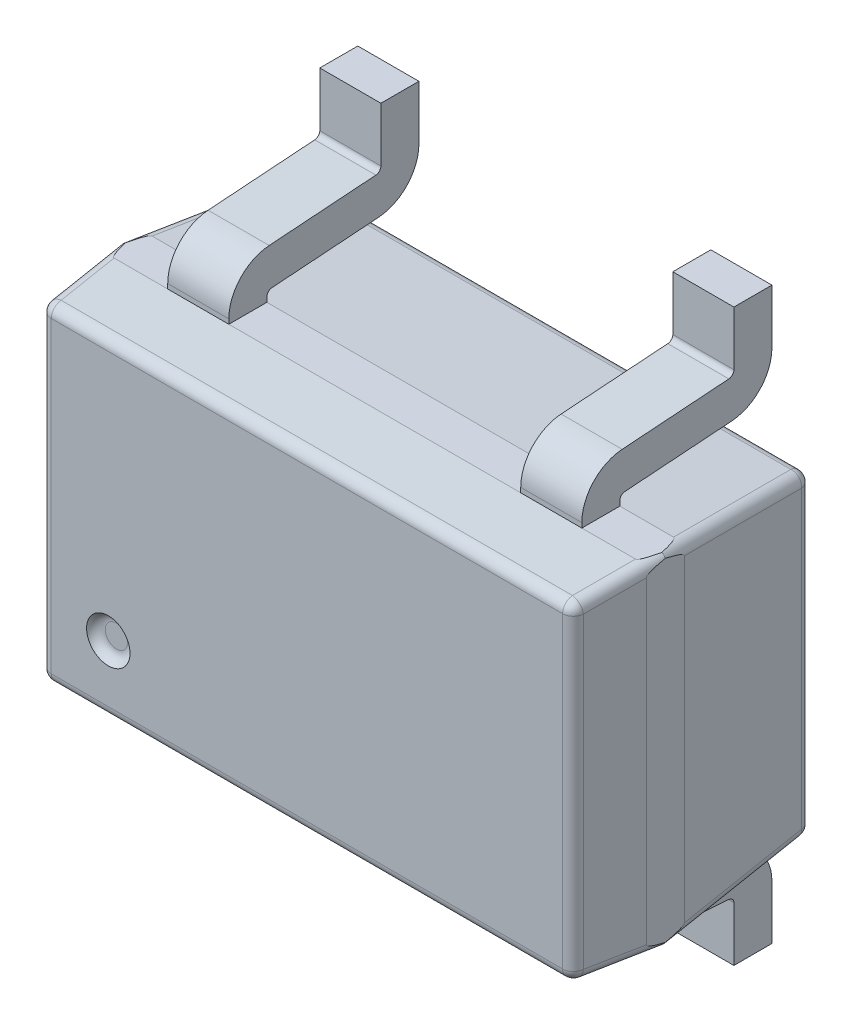
from build123d import *
from OCP.BRepFilletAPI import BRepFilletAPI_MakeChamfer

# Parameters (mm, degrees)
SALIENTE_EXTRUIR1_START = 0.05
CROQUIS1_W              = 2
CROQUIS1_H              = 1.25
SALIENTE_EXTRUIR1_DEPTH = 0.51
CHAFL_N1_SIZE           = 0.51
CHAFL_N1_SIZE_2         = 0.044619218
CROQUIS2_W              = 2
CROQUIS2_H              = 1.25
SALIENTE_EXTRUIR2_DEPTH = 0.39
CHAFL_N2_SIZE           = 0.25
CHAFL_N2_SIZE2          = 0.021872166
REDONDEO1_R             = 0.04
EXTRUIR_L_MINA1_DEPTH   = 0.1125
MATRIZL2_COUNT          = 2
MATRIZL2_PITCH          = 0.65
MATRIZL2_COL_COUNT      = 2
MATRIZL2_COL_PITCH      = 0.65
SIMETR_A2_COPY_1_DEPTH  = 0.1125
SIMETR_A2_COPY_2_DEPTH  = 0.1125
CROQUIS7_W              = 0.7
CROQUIS7_H              = 0.425
CORTAR_EXTRUIR1_DEPTH   = 0.225
CROQUIS8_R              = 0.08
CORTAR_EXTRUIR3_DEPTH   = 0.03
REDONDEO2_R             = 0.04


with BuildPart() as part:
    # Croquis1 → Saliente-Extruir1 (new body)
    with BuildSketch(Plane.XY.offset(SALIENTE_EXTRUIR1_START)):
        Rectangle(CROQUIS1_W, CROQUIS1_H)
    extrude(amount=SALIENTE_EXTRUIR1_DEPTH)

    # Chaflán1
    # the kernel refuses this chamfer: 0.51, 0.044619218 mm, written as the material it takes off along each edge
    with BuildSketch(Plane(origin=(2.325813381, 0.625, 0.05), x_dir=(0, 0, 1), z_dir=(-1, 0, 0)), Plane(origin=(-2.325813381, -0.625, 0.05), x_dir=(0, 0, 1), z_dir=(1, 0, 0))) as chafl_n1_piece_1:
        Polygon((CHAFL_N1_SIZE, 0), (0, -CHAFL_N1_SIZE_2 * 1.00000000892), (0, 0), align=None)
    extrude(amount=4.651626761, mode=Mode.SUBTRACT)
    with BuildSketch(Plane(origin=(-1, 1.950813381, 0.05), x_dir=(0, 0, 1), z_dir=(0, -1, 0)), Plane(origin=(1, -1.950813381, 0.05), x_dir=(0, 0, 1), z_dir=(0, 1, 0))) as chafl_n1_piece_2:
        Polygon((CHAFL_N1_SIZE, 0), (0, -CHAFL_N1_SIZE_2 * 1.00000000892), (0, 0), align=None)
    extrude(amount=3.901626761, mode=Mode.SUBTRACT)

    # Croquis2 → Saliente-Extruir2 (add)
    with BuildSketch(Plane.XY.offset(0.56)):
        Rectangle(CROQUIS2_W, CROQUIS2_H)
    extrude(amount=SALIENTE_EXTRUIR2_DEPTH)

    # Chaflán2: one chamfer whose edges measure the first distance from different faces: ONE call of the kernel's chamfer builder (chamfer() names one face for all edges)
    chafl_n2_edges_1 = [part.edges().sort_by_distance(p)[0] for p in [
        (1, 0, 0.95),
    ]]
    chafl_n2_side_1 = [part.faces().sort_by_distance(p)[0] for p in [
        (1, 0, 0.755),
    ]]
    chafl_n2_edges_2 = [part.edges().sort_by_distance(p)[0] for p in [
        (0, 0.625, 0.95),
    ]]
    chafl_n2_side_2 = [part.faces().sort_by_distance(p)[0] for p in [
        (0, 0.625, 0.755),
    ]]
    chafl_n2_edges_3 = [part.edges().sort_by_distance(p)[0] for p in [
        (-1, 0, 0.95),
    ]]
    chafl_n2_side_3 = [part.faces().sort_by_distance(p)[0] for p in [
        (-1, 0, 0.755),
    ]]
    chafl_n2_edges_4 = [part.edges().sort_by_distance(p)[0] for p in [
        (0, -0.625, 0.95),
    ]]
    chafl_n2_side_4 = [part.faces().sort_by_distance(p)[0] for p in [
        (0, -0.625, 0.755),
    ]]
    chafl_n2 = BRepFilletAPI_MakeChamfer(part.part.solid().wrapped)
    for e in chafl_n2_edges_1:
        chafl_n2.Add(CHAFL_N2_SIZE, CHAFL_N2_SIZE2, e.wrapped, chafl_n2_side_1[0].wrapped)  # the first distance lies on this face
    for e in chafl_n2_edges_2:
        chafl_n2.Add(CHAFL_N2_SIZE, CHAFL_N2_SIZE2, e.wrapped, chafl_n2_side_2[0].wrapped)  # the first distance lies on this face
    for e in chafl_n2_edges_3:
        chafl_n2.Add(CHAFL_N2_SIZE, CHAFL_N2_SIZE2, e.wrapped, chafl_n2_side_3[0].wrapped)  # the first distance lies on this face
    for e in chafl_n2_edges_4:
        chafl_n2.Add(CHAFL_N2_SIZE, CHAFL_N2_SIZE2, e.wrapped, chafl_n2_side_4[0].wrapped)  # the first distance lies on this face
    add(Compound.cast(chafl_n2.Shape()), mode=Mode.REPLACE)

    # Redondeo1
    # the kernel refuses this fillet: 0.04 mm, written as the material it takes off along each edge
    with BuildSketch(Plane(origin=(0.918727535, 0.543727535, 0.09), x_dir=(-0.7071067811865475, 0.7071067811865475, 0), z_dir=(0.5431604763461051, 0.5431604763461051, -0.6402760294364802))) as redondeo1_piece_1_section:
        Polygon((-0.0785695, -0.0785695), (0.0785695, -0.0785695), (0.0785695, 0.0785695), (-0.0785695, 0.0785695), align=None)
    redondeo1_piece_1 = extrude(amount=0.0785695, mode=Mode.PRIVATE)
    redondeo1_piece_1 = split(redondeo1_piece_1, bisect_by=Plane(origin=(0.918727535, 0.543727535, 0.09), z_dir=(0, 1, 0)), keep=Keep.TOP, mode=Mode.PRIVATE)
    redondeo1_piece_1 = split(redondeo1_piece_1, bisect_by=Plane(origin=(0.918727535, 0.543727535, 0.09), z_dir=(-0.08682659386383014, -0.08682659386383014, -0.9924325091390401)), keep=Keep.TOP, mode=Mode.PRIVATE)
    redondeo1_piece_1 = split(redondeo1_piece_1, bisect_by=Plane(origin=(0.918727535, 0.543727535, 0.09), z_dir=(1, 0, 0)), keep=Keep.TOP, mode=Mode.PRIVATE)
    redondeo1_piece_1 = split(redondeo1_piece_1, bisect_by=Plane(origin=(0.918727535, 0.543727535, 0.05), z_dir=(0, 0, 1)), keep=Keep.TOP, mode=Mode.PRIVATE)
    redondeo1_piece_1 = split(redondeo1_piece_1, bisect_by=Plane(origin=(0.958575323, 0.543727535, 0.08651377), z_dir=(-0.9961946980917825, 0, 0.08715574274723596)), keep=Keep.TOP, mode=Mode.PRIVATE)
    redondeo1_piece_1 = split(redondeo1_piece_1, bisect_by=Plane(origin=(0.918727535, 0.583575323, 0.08651377), z_dir=(0, -0.9961946980917825, 0.08715574274723596)), keep=Keep.TOP, mode=Mode.PRIVATE)
    redondeo1_piece_1 = redondeo1_piece_1 - Plane(origin=(0.918727535, 0.543727535, 0.09), x_dir=(-0.5431604763461051, -0.5431604763461051, 0.6402760294364802), z_dir=(-0.7071067811865475, 0.7071067811865475, 0)) * Sphere(REDONDEO1_R, mode=Mode.PRIVATE)
    add(redondeo1_piece_1, mode=Mode.SUBTRACT)
    with BuildSketch(Plane(origin=(-0.918727535, 0.543727535, 0.09), x_dir=(-0.7071067811865475, -0.7071067811865475, 0), z_dir=(-0.5431604763461051, 0.5431604763461051, -0.6402760294364802))) as redondeo1_piece_2_section:
        Polygon((-0.0785695, -0.0785695), (0.0785695, -0.0785695), (0.0785695, 0.0785695), (-0.0785695, 0.0785695), align=None)
    redondeo1_piece_2 = extrude(amount=0.0785695, mode=Mode.PRIVATE)
    redondeo1_piece_2 = split(redondeo1_piece_2, bisect_by=Plane(origin=(-0.918727535, 0.543727535, 0.09), z_dir=(-1, 0, 0)), keep=Keep.TOP, mode=Mode.PRIVATE)
    redondeo1_piece_2 = split(redondeo1_piece_2, bisect_by=Plane(origin=(-0.918727535, 0.543727535, 0.09), z_dir=(0.08682659386383014, -0.08682659386383014, -0.9924325091390401)), keep=Keep.TOP, mode=Mode.PRIVATE)
    redondeo1_piece_2 = split(redondeo1_piece_2, bisect_by=Plane(origin=(-0.918727535, 0.543727535, 0.09), z_dir=(0, 1, 0)), keep=Keep.TOP, mode=Mode.PRIVATE)
    redondeo1_piece_2 = split(redondeo1_piece_2, bisect_by=Plane(origin=(-0.918727535, 0.543727535, 0.05), z_dir=(0, 0, 1)), keep=Keep.TOP, mode=Mode.PRIVATE)
    redondeo1_piece_2 = split(redondeo1_piece_2, bisect_by=Plane(origin=(-0.918727535, 0.583575323, 0.08651377), z_dir=(0, -0.9961946980917825, 0.08715574274723596)), keep=Keep.TOP, mode=Mode.PRIVATE)
    redondeo1_piece_2 = split(redondeo1_piece_2, bisect_by=Plane(origin=(-0.958575323, 0.543727535, 0.08651377), z_dir=(0.9961946980917825, 0, 0.08715574274723596)), keep=Keep.TOP, mode=Mode.PRIVATE)
    redondeo1_piece_2 = redondeo1_piece_2 - Plane(origin=(-0.918727535, 0.543727535, 0.09), x_dir=(0.5431604763461051, -0.5431604763461051, 0.6402760294364802), z_dir=(-0.7071067811865475, -0.7071067811865475, 0)) * Sphere(REDONDEO1_R, mode=Mode.PRIVATE)
    add(redondeo1_piece_2, mode=Mode.SUBTRACT)
    with BuildSketch(Plane(origin=(-0.918727535, -0.543727535, 0.09), x_dir=(0.7071067811865475, -0.7071067811865475, 0), z_dir=(-0.5431604763461051, -0.5431604763461051, -0.6402760294364802))) as redondeo1_piece_3_section:
        Polygon((-0.0785695, -0.0785695), (0.0785695, -0.0785695), (0.0785695, 0.0785695), (-0.0785695, 0.0785695), align=None)
    redondeo1_piece_3 = extrude(amount=0.0785695, mode=Mode.PRIVATE)
    redondeo1_piece_3 = split(redondeo1_piece_3, bisect_by=Plane(origin=(-0.918727535, -0.543727535, 0.09), z_dir=(-1, 0, 0)), keep=Keep.TOP, mode=Mode.PRIVATE)
    redondeo1_piece_3 = split(redondeo1_piece_3, bisect_by=Plane(origin=(-0.918727535, -0.543727535, 0.09), z_dir=(0.08682659386383014, 0.08682659386383014, -0.9924325091390401)), keep=Keep.TOP, mode=Mode.PRIVATE)
    redondeo1_piece_3 = split(redondeo1_piece_3, bisect_by=Plane(origin=(-0.918727535, -0.543727535, 0.09), z_dir=(0, -1, 0)), keep=Keep.TOP, mode=Mode.PRIVATE)
    redondeo1_piece_3 = split(redondeo1_piece_3, bisect_by=Plane(origin=(-0.918727535, -0.543727535, 0.05), z_dir=(0, 0, 1)), keep=Keep.TOP, mode=Mode.PRIVATE)
    redondeo1_piece_3 = split(redondeo1_piece_3, bisect_by=Plane(origin=(-0.918727535, -0.583575323, 0.08651377), z_dir=(0, 0.9961946980917825, 0.08715574274723596)), keep=Keep.TOP, mode=Mode.PRIVATE)
    redondeo1_piece_3 = split(redondeo1_piece_3, bisect_by=Plane(origin=(-0.958575323, -0.543727535, 0.08651377), z_dir=(0.9961946980917825, 0, 0.08715574274723596)), keep=Keep.TOP, mode=Mode.PRIVATE)
    redondeo1_piece_3 = redondeo1_piece_3 - Plane(origin=(-0.918727535, -0.543727535, 0.09), x_dir=(0.5431604763461051, 0.5431604763461051, 0.6402760294364802), z_dir=(0.7071067811865475, -0.7071067811865475, 0)) * Sphere(REDONDEO1_R, mode=Mode.PRIVATE)
    add(redondeo1_piece_3, mode=Mode.SUBTRACT)
    with BuildSketch(Plane(origin=(0.918727535, -0.543727535, 0.09), x_dir=(0.05900350758257069, -0.7359928340769734, 0.6744131777184507), z_dir=(0.5431604763461051, -0.5431604763461051, -0.6402760294364802))) as redondeo1_piece_4_section:
        Polygon((-0.0785695, -0.0785695), (0.0785695, -0.0785695), (0.0785695, 0.0785695), (-0.0785695, 0.0785695), align=None)
    redondeo1_piece_4 = extrude(amount=0.0785695, mode=Mode.PRIVATE)
    redondeo1_piece_4 = split(redondeo1_piece_4, bisect_by=Plane(origin=(0.918727535, -0.543727535, 0.09), z_dir=(0, -1, 0)), keep=Keep.TOP, mode=Mode.PRIVATE)
    redondeo1_piece_4 = split(redondeo1_piece_4, bisect_by=Plane(origin=(0.918727535, -0.543727535, 0.09), z_dir=(1, 0, 0)), keep=Keep.TOP, mode=Mode.PRIVATE)
    redondeo1_piece_4 = split(redondeo1_piece_4, bisect_by=Plane(origin=(0.918727535, -0.543727535, 0.09), z_dir=(-0.08682659386383014, 0.08682659386383014, -0.9924325091390401)), keep=Keep.TOP, mode=Mode.PRIVATE)
    redondeo1_piece_4 = split(redondeo1_piece_4, bisect_by=Plane(origin=(0.958575323, -0.543727535, 0.08651377), z_dir=(-0.9961946980917825, 0, 0.08715574274723596)), keep=Keep.TOP, mode=Mode.PRIVATE)
    redondeo1_piece_4 = split(redondeo1_piece_4, bisect_by=Plane(origin=(0.918727535, -0.543727535, 0.05), z_dir=(0, 0, 1)), keep=Keep.TOP, mode=Mode.PRIVATE)
    redondeo1_piece_4 = split(redondeo1_piece_4, bisect_by=Plane(origin=(0.918727535, -0.583575323, 0.08651377), z_dir=(0, 0.9961946980917825, 0.08715574274723596)), keep=Keep.TOP, mode=Mode.PRIVATE)
    redondeo1_piece_4 = redondeo1_piece_4 - Plane(origin=(0.918727535, -0.543727535, 0.09), x_dir=(-0.5431604763461051, 0.5431604763461051, 0.6402760294364802), z_dir=(0.05900350758257069, -0.7359928340769734, 0.6744131777184507)) * Sphere(REDONDEO1_R, mode=Mode.PRIVATE)
    add(redondeo1_piece_4, mode=Mode.SUBTRACT)
    with BuildSketch(Plane(origin=(0.941474587, -0.566474587, 0.91), x_dir=(-0.7071067811865476, -0.7071067811865476, 0), z_dir=(0.5431604763459367, -0.5431604763459367, 0.6402760294367659))) as redondeo1_piece_5_section:
        Polygon((-0.0785695, -0.0785695), (0.0785695, -0.0785695), (0.0785695, 0.0785695), (-0.0785695, 0.0785695), align=None)
    redondeo1_piece_5 = extrude(amount=0.0785695, mode=Mode.PRIVATE)
    redondeo1_piece_5 = split(redondeo1_piece_5, bisect_by=Plane(origin=(0.941474587, -0.566474587, 0.91), z_dir=(0, -1, 0)), keep=Keep.TOP, mode=Mode.PRIVATE)
    redondeo1_piece_5 = split(redondeo1_piece_5, bisect_by=Plane(origin=(0.941474587, -0.566474587, 0.91), z_dir=(-0.08682659386424758, 0.08682659386424758, 0.9924325091389671)), keep=Keep.TOP, mode=Mode.PRIVATE)
    redondeo1_piece_5 = split(redondeo1_piece_5, bisect_by=Plane(origin=(0.941474587, -0.566474587, 0.91), z_dir=(1, 0, 0)), keep=Keep.TOP, mode=Mode.PRIVATE)
    redondeo1_piece_5 = split(redondeo1_piece_5, bisect_by=Plane(origin=(0.941474587, -0.566474587, 0.95), z_dir=(0, 0, -1)), keep=Keep.TOP, mode=Mode.PRIVATE)
    redondeo1_piece_5 = split(redondeo1_piece_5, bisect_by=Plane(origin=(0.981322375, -0.566474587, 0.91348623), z_dir=(-0.9961946980917455, 0, -0.08715574274765817)), keep=Keep.TOP, mode=Mode.PRIVATE)
    redondeo1_piece_5 = split(redondeo1_piece_5, bisect_by=Plane(origin=(0.941474587, -0.606322375, 0.91348623), z_dir=(0, 0.9961946980917455, -0.08715574274765817)), keep=Keep.TOP, mode=Mode.PRIVATE)
    redondeo1_piece_5 = redondeo1_piece_5 - Plane(origin=(0.941474587, -0.566474587, 0.91), x_dir=(-0.5431604763459367, 0.5431604763459367, -0.6402760294367659), z_dir=(-0.7071067811865476, -0.7071067811865476, 0)) * Sphere(REDONDEO1_R, mode=Mode.PRIVATE)
    add(redondeo1_piece_5, mode=Mode.SUBTRACT)
    with BuildSketch(Plane(origin=(0.941474587, 0.566474587, 0.91), x_dir=(0.7071067811865476, -0.7071067811865476, 0), z_dir=(0.5431604763459367, 0.5431604763459367, 0.6402760294367659))) as redondeo1_piece_6_section:
        Polygon((-0.0785695, -0.0785695), (0.0785695, -0.0785695), (0.0785695, 0.0785695), (-0.0785695, 0.0785695), align=None)
    redondeo1_piece_6 = extrude(amount=0.0785695, mode=Mode.PRIVATE)
    redondeo1_piece_6 = split(redondeo1_piece_6, bisect_by=Plane(origin=(0.941474587, 0.566474587, 0.91), z_dir=(0, 1, 0)), keep=Keep.TOP, mode=Mode.PRIVATE)
    redondeo1_piece_6 = split(redondeo1_piece_6, bisect_by=Plane(origin=(0.941474587, 0.566474587, 0.91), z_dir=(-0.08682659386424758, -0.08682659386424758, 0.9924325091389671)), keep=Keep.TOP, mode=Mode.PRIVATE)
    redondeo1_piece_6 = split(redondeo1_piece_6, bisect_by=Plane(origin=(0.941474587, 0.566474587, 0.91), z_dir=(1, 0, 0)), keep=Keep.TOP, mode=Mode.PRIVATE)
    redondeo1_piece_6 = split(redondeo1_piece_6, bisect_by=Plane(origin=(0.941474587, 0.566474587, 0.95), z_dir=(0, 0, -1)), keep=Keep.TOP, mode=Mode.PRIVATE)
    redondeo1_piece_6 = split(redondeo1_piece_6, bisect_by=Plane(origin=(0.981322375, 0.566474587, 0.91348623), z_dir=(-0.9961946980917455, 0, -0.08715574274765817)), keep=Keep.TOP, mode=Mode.PRIVATE)
    redondeo1_piece_6 = split(redondeo1_piece_6, bisect_by=Plane(origin=(0.941474587, 0.606322375, 0.91348623), z_dir=(0, -0.9961946980917455, -0.08715574274765817)), keep=Keep.TOP, mode=Mode.PRIVATE)
    redondeo1_piece_6 = redondeo1_piece_6 - Plane(origin=(0.941474587, 0.566474587, 0.91), x_dir=(-0.5431604763459367, -0.5431604763459367, -0.6402760294367659), z_dir=(0.7071067811865476, -0.7071067811865476, 0)) * Sphere(REDONDEO1_R, mode=Mode.PRIVATE)
    add(redondeo1_piece_6, mode=Mode.SUBTRACT)
    with BuildSketch(Plane(origin=(-0.941474587, -0.566474587, 0.91), x_dir=(-0.7071067811865476, 0.7071067811865476, 0), z_dir=(-0.5431604763459367, -0.5431604763459367, 0.6402760294367659))) as redondeo1_piece_7_section:
        Polygon((-0.0785695, -0.0785695), (0.0785695, -0.0785695), (0.0785695, 0.0785695), (-0.0785695, 0.0785695), align=None)
    redondeo1_piece_7 = extrude(amount=0.0785695, mode=Mode.PRIVATE)
    redondeo1_piece_7 = split(redondeo1_piece_7, bisect_by=Plane(origin=(-0.941474587, -0.566474587, 0.91), z_dir=(-1, 0, 0)), keep=Keep.TOP, mode=Mode.PRIVATE)
    redondeo1_piece_7 = split(redondeo1_piece_7, bisect_by=Plane(origin=(-0.941474587, -0.566474587, 0.91), z_dir=(0.08682659386424758, 0.08682659386424758, 0.9924325091389671)), keep=Keep.TOP, mode=Mode.PRIVATE)
    redondeo1_piece_7 = split(redondeo1_piece_7, bisect_by=Plane(origin=(-0.941474587, -0.566474587, 0.91), z_dir=(0, -1, 0)), keep=Keep.TOP, mode=Mode.PRIVATE)
    redondeo1_piece_7 = split(redondeo1_piece_7, bisect_by=Plane(origin=(-0.941474587, -0.566474587, 0.95), z_dir=(0, 0, -1)), keep=Keep.TOP, mode=Mode.PRIVATE)
    redondeo1_piece_7 = split(redondeo1_piece_7, bisect_by=Plane(origin=(-0.941474587, -0.606322375, 0.91348623), z_dir=(0, 0.9961946980917455, -0.08715574274765817)), keep=Keep.TOP, mode=Mode.PRIVATE)
    redondeo1_piece_7 = split(redondeo1_piece_7, bisect_by=Plane(origin=(-0.981322375, -0.566474587, 0.91348623), z_dir=(0.9961946980917455, 0, -0.08715574274765817)), keep=Keep.TOP, mode=Mode.PRIVATE)
    redondeo1_piece_7 = redondeo1_piece_7 - Plane(origin=(-0.941474587, -0.566474587, 0.91), x_dir=(0.5431604763459367, 0.5431604763459367, -0.6402760294367659), z_dir=(-0.7071067811865476, 0.7071067811865476, 0)) * Sphere(REDONDEO1_R, mode=Mode.PRIVATE)
    add(redondeo1_piece_7, mode=Mode.SUBTRACT)
    with BuildSketch(Plane(origin=(-0.941474587, 0.566474587, 0.91), x_dir=(0.7071067811865476, 0.7071067811865476, 0), z_dir=(-0.5431604763459367, 0.5431604763459367, 0.6402760294367659))) as redondeo1_piece_8_section:
        Polygon((-0.0785695, -0.0785695), (0.0785695, -0.0785695), (0.0785695, 0.0785695), (-0.0785695, 0.0785695), align=None)
    redondeo1_piece_8 = extrude(amount=0.0785695, mode=Mode.PRIVATE)
    redondeo1_piece_8 = split(redondeo1_piece_8, bisect_by=Plane(origin=(-0.941474587, 0.566474587, 0.91), z_dir=(-1, 0, 0)), keep=Keep.TOP, mode=Mode.PRIVATE)
    redondeo1_piece_8 = split(redondeo1_piece_8, bisect_by=Plane(origin=(-0.941474587, 0.566474587, 0.91), z_dir=(0.08682659386424758, -0.08682659386424758, 0.9924325091389671)), keep=Keep.TOP, mode=Mode.PRIVATE)
    redondeo1_piece_8 = split(redondeo1_piece_8, bisect_by=Plane(origin=(-0.941474587, 0.566474587, 0.91), z_dir=(0, 1, 0)), keep=Keep.TOP, mode=Mode.PRIVATE)
    redondeo1_piece_8 = split(redondeo1_piece_8, bisect_by=Plane(origin=(-0.941474587, 0.566474587, 0.95), z_dir=(0, 0, -1)), keep=Keep.TOP, mode=Mode.PRIVATE)
    redondeo1_piece_8 = split(redondeo1_piece_8, bisect_by=Plane(origin=(-0.941474587, 0.606322375, 0.91348623), z_dir=(0, -0.9961946980917455, -0.08715574274765817)), keep=Keep.TOP, mode=Mode.PRIVATE)
    redondeo1_piece_8 = split(redondeo1_piece_8, bisect_by=Plane(origin=(-0.981322375, 0.566474587, 0.91348623), z_dir=(0.9961946980917455, 0, -0.08715574274765817)), keep=Keep.TOP, mode=Mode.PRIVATE)
    redondeo1_piece_8 = redondeo1_piece_8 - Plane(origin=(-0.941474587, 0.566474587, 0.91), x_dir=(0.5431604763459367, -0.5431604763459367, -0.6402760294367659), z_dir=(0.7071067811865476, 0.7071067811865476, 0)) * Sphere(REDONDEO1_R, mode=Mode.PRIVATE)
    add(redondeo1_piece_8, mode=Mode.SUBTRACT)
    with BuildSketch(Plane(origin=(0.918727535, 0.580380782, 0.05), x_dir=(0, -1, 0), z_dir=(-1, 0, 0))) as redondeo1_piece_9:
        with BuildLine():
            CenterArc((REDONDEO1_R * 0.916331174018, REDONDEO1_R), REDONDEO1_R, 185, 85)
            Line((-REDONDEO1_R * 0.079863524074, REDONDEO1_R * 0.912844257253), (0, 0))
            Line((0, 0), (REDONDEO1_R * 0.916331174018, 0))
        make_face()
    extrude(amount=1.837455069, mode=Mode.SUBTRACT)
    with BuildSketch(Plane(origin=(-0.955380782, 0.543727535, 0.05), x_dir=(-0.08715574274723663, 0, 0.9961946980917824), z_dir=(0, -1, 0))) as redondeo1_piece_10:
        with BuildLine():
            CenterArc((REDONDEO1_R * 0.916331174018, -REDONDEO1_R), REDONDEO1_R, 90, 85)
            Line((-REDONDEO1_R * 0.079863524074, -REDONDEO1_R * 0.912844257253), (0, 0))
            Line((0, 0), (REDONDEO1_R * 0.916331174018, 0))
        make_face()
    extrude(amount=1.087455069, mode=Mode.SUBTRACT)
    with BuildSketch(Plane(origin=(-0.918727535, -0.580380782, 0.05), x_dir=(0, -0.08715574274723663, 0.9961946980917824), z_dir=(1, 0, 0))) as redondeo1_piece_11:
        with BuildLine():
            CenterArc((REDONDEO1_R * 0.916331174018, -REDONDEO1_R), REDONDEO1_R, 90, 85)
            Line((-REDONDEO1_R * 0.079863524074, -REDONDEO1_R * 0.912844257253), (0, 0))
            Line((0, 0), (REDONDEO1_R * 0.916331174018, 0))
        make_face()
    extrude(amount=1.837455069, mode=Mode.SUBTRACT)
    with BuildSketch(Plane(origin=(0.955380782, -0.543727535, 0.05), x_dir=(-1, 0, 0), z_dir=(0, 1, 0))) as redondeo1_piece_12:
        with BuildLine():
            CenterArc((REDONDEO1_R * 0.916331174018, REDONDEO1_R), REDONDEO1_R, 185, 85)
            Line((-REDONDEO1_R * 0.079863524074, REDONDEO1_R * 0.912844257253), (0, 0))
            Line((0, 0), (REDONDEO1_R * 0.916331174018, 0))
        make_face()
    extrude(amount=1.087455069, mode=Mode.SUBTRACT)
    with BuildSketch(Plane(origin=(0.978127834, -0.566474587, 0.95), x_dir=(-1, 0, 0), z_dir=(0, 1, 0))) as redondeo1_piece_13:
        with BuildLine():
            CenterArc((REDONDEO1_R * 0.916331174017, -REDONDEO1_R), REDONDEO1_R, 90, 85)
            Line((-REDONDEO1_R * 0.0798635240743, -REDONDEO1_R * 0.912844257252), (0, 0))
            Line((0, 0), (REDONDEO1_R * 0.916331174017, 0))
        make_face()
    extrude(amount=1.132949174, mode=Mode.SUBTRACT)
    with BuildSketch(Plane(origin=(-0.941474587, -0.603127834, 0.95), x_dir=(0, -0.08715574274765546, -0.9961946980917458), z_dir=(1, 0, 0))) as redondeo1_piece_14:
        with BuildLine():
            CenterArc((REDONDEO1_R * 0.916331174017, REDONDEO1_R), REDONDEO1_R, 185, 85)
            Line((-REDONDEO1_R * 0.0798635240743, REDONDEO1_R * 0.912844257252), (0, 0))
            Line((0, 0), (REDONDEO1_R * 0.916331174017, 0))
        make_face()
    extrude(amount=1.882949174, mode=Mode.SUBTRACT)
    with BuildSketch(Plane(origin=(-0.978127834, 0.566474587, 0.95), x_dir=(-0.08715574274765546, 0, -0.9961946980917458), z_dir=(0, -1, 0))) as redondeo1_piece_15:
        with BuildLine():
            CenterArc((REDONDEO1_R * 0.916331174017, REDONDEO1_R), REDONDEO1_R, 185, 85)
            Line((-REDONDEO1_R * 0.0798635240743, REDONDEO1_R * 0.912844257252), (0, 0))
            Line((0, 0), (REDONDEO1_R * 0.916331174017, 0))
        make_face()
    extrude(amount=1.132949174, mode=Mode.SUBTRACT)
    with BuildSketch(Plane(origin=(0.941474587, 0.603127834, 0.95), x_dir=(0, -1, 0), z_dir=(-1, 0, 0))) as redondeo1_piece_16:
        with BuildLine():
            CenterArc((REDONDEO1_R * 0.916331174017, -REDONDEO1_R), REDONDEO1_R, 90, 85)
            Line((-REDONDEO1_R * 0.0798635240743, -REDONDEO1_R * 0.912844257252), (0, 0))
            Line((0, 0), (REDONDEO1_R * 0.916331174017, 0))
        make_face()
    extrude(amount=1.882949174, mode=Mode.SUBTRACT)
    with BuildSketch(Plane(origin=(0.958274916, -0.583274916, 0.083080105), x_dir=(-0.9962234400966509, -0.007567436278422571, 0.08649619246051539), z_dir=(0.08682659386383014, -0.08682659386383014, 0.9924325091390401)), Plane(origin=(-1.043084767, -0.668084767, 1.052461143), x_dir=(0.9962234400966511, -0.007567436278414003, 0.08649619246051615), z_dir=(0.08682659386383014, 0.08682659386383014, -0.9924325091390401))) as redondeo1_piece_17:
        with BuildLine():
            CenterArc((REDONDEO1_R * 0.992432509139, -REDONDEO1_R), REDONDEO1_R, 90, 89.564769998)
            Line((-REDONDEO1_R * 0.00753863989871, -REDONDEO1_R * 0.992403876506), (0, 0))
            Line((0, 0), (REDONDEO1_R * 0.992432509139, 0))
        make_face()
    extrude(amount=0.976772757, mode=Mode.SUBTRACT)
    with BuildSketch(Plane(origin=(1.043084767, -0.668084767, 0.207538857), x_dir=(-0.9962234400966146, -0.0075674362784873385, -0.08649619246092878), z_dir=(-0.08682659386424758, 0.08682659386424758, 0.9924325091389671)), Plane(origin=(1.043084767, 0.668084767, 0.207538857), x_dir=(0.007567436278490113, -0.9962234400966146, -0.08649619246092853), z_dir=(-0.08682659386424758, -0.08682659386424758, 0.9924325091389671))) as redondeo1_piece_18:
        with BuildLine():
            CenterArc((REDONDEO1_R * 0.992432509139, -REDONDEO1_R), REDONDEO1_R, 90, 89.564769998)
            Line((-REDONDEO1_R * 0.00753863989877, -REDONDEO1_R * 0.992403876506), (0, 0))
            Line((0, 0), (REDONDEO1_R * 0.992432509139, 0))
        make_face()
    extrude(amount=0.714790206, mode=Mode.SUBTRACT)
    with BuildSketch(Plane(origin=(1.043084767, 0.668084767, 1.052461143), x_dir=(0.007567436278422329, -0.9962234400966511, 0.08649619246051542), z_dir=(-0.08682659386383014, -0.08682659386383014, -0.9924325091390401)), Plane(origin=(-0.958274916, 0.583274916, 0.083080105), x_dir=(-0.007567436278411347, -0.9962234400966509, 0.08649619246051636), z_dir=(-0.08682659386383014, 0.08682659386383014, 0.9924325091390401))) as redondeo1_piece_19:
        with BuildLine():
            CenterArc((REDONDEO1_R * 0.992432509139, REDONDEO1_R), REDONDEO1_R, 180.435230002, 89.564769998)
            Line((-REDONDEO1_R * 0.00753863989871, REDONDEO1_R * 0.992403876506), (0, 0))
            Line((0, 0), (REDONDEO1_R * 0.992432509139, 0))
        make_face()
    extrude(amount=0.976772757, mode=Mode.SUBTRACT)
    with BuildSketch(Plane(origin=(-1.043084767, 0.668084767, 0.207538857), x_dir=(-0.007567436278490112, -0.9962234400966146, -0.08649619246092852), z_dir=(0.08682659386424758, -0.08682659386424758, 0.9924325091389671)), Plane(origin=(-1.043084767, -0.668084767, 0.207538857), x_dir=(0.9962234400966146, -0.0075674362784873385, -0.08649619246092878), z_dir=(0.08682659386424758, 0.08682659386424758, 0.9924325091389671))) as redondeo1_piece_20:
        with BuildLine():
            CenterArc((REDONDEO1_R * 0.992432509139, REDONDEO1_R), REDONDEO1_R, 180.435230002, 89.564769998)
            Line((-REDONDEO1_R * 0.00753863989878, REDONDEO1_R * 0.992403876506), (0, 0))
            Line((0, 0), (REDONDEO1_R * 0.992432509139, 0))
        make_face()
    extrude(amount=0.714790206, mode=Mode.SUBTRACT)

    # Croquis4 → Extruir-Lámina1 (add, symmetric)
    with BuildSketch(Plane(origin=(0, 0, 0), x_dir=(0, 0, -1), z_dir=(1, 0, 0))):
        with BuildLine():
            Line((-0.56, -0.625), (-0.56, -0.642398543))
            ThreePointArc((-0.56, -0.642398543), (-0.554637261, -0.656027578), (-0.541424941, -0.662347717))
            Line((-0.541424941, -0.662347717), (-0.148600472, -0.690406608))
            ThreePointArc((-0.148600472, -0.690406608), (-0.042901912, -0.740967721), (0, -0.85))
            Line((0, -0.85), (0, -1.05))
            Line((0, -1.05), (-0.14, -1.05))
            Line((-0.14, -1.05), (-0.14, -0.85))
            ThreePointArc((-0.14, -0.85), (-0.145362739, -0.836370965), (-0.158575059, -0.830050826))
            Line((-0.158575059, -0.830050826), (-0.551399528, -0.801991935))
            ThreePointArc((-0.551399528, -0.801991935), (-0.657098088, -0.751430822), (-0.7, -0.642398543))
            Line((-0.7, -0.642398543), (-0.7, -0.625))
            Line((-0.7, -0.625), (-0.56, -0.625))
        make_face()
    extruir_l_mina1 = extrude(amount=EXTRUIR_L_MINA1_DEPTH, both=True)

    # MatrizL2: Extruir-Lámina1 ×2
    with Locations(*[(i * MATRIZL2_PITCH, 0, 0) for i in range(1, MATRIZL2_COUNT)]):
        add(extruir_l_mina1)

    # MatrizL2 col: Extruir-Lámina1 ×2
    with Locations(*[(-i * MATRIZL2_COL_PITCH, 0, 0) for i in range(1, MATRIZL2_COL_COUNT)]):
        add(extruir_l_mina1)

    # Simetría2: Extruir-Lámina1 across plane
    add(extruir_l_mina1.mirror(Plane.ZX))

    # Simetría2 copy 1 sketch → Simetría2 copy 1 (add, symmetric)
    with BuildSketch(Plane(origin=(0.65, 0, 0), x_dir=(0, 0, -1), z_dir=(1, 0, 0))):
        with BuildLine():
            Line((-0.56, 0.625), (-0.56, 0.642398543))
            ThreePointArc((-0.56, 0.642398543), (-0.554637261, 0.656027578), (-0.541424941, 0.662347717))
            Line((-0.541424941, 0.662347717), (-0.148600472, 0.690406608))
            ThreePointArc((-0.148600472, 0.690406608), (-0.042901912, 0.740967721), (0, 0.85))
            Line((0, 0.85), (0, 1.05))
            Line((0, 1.05), (-0.14, 1.05))
            Line((-0.14, 1.05), (-0.14, 0.85))
            ThreePointArc((-0.14, 0.85), (-0.145362739, 0.836370965), (-0.158575059, 0.830050826))
            Line((-0.158575059, 0.830050826), (-0.551399528, 0.801991935))
            ThreePointArc((-0.551399528, 0.801991935), (-0.657098088, 0.751430822), (-0.7, 0.642398543))
            Line((-0.7, 0.642398543), (-0.7, 0.625))
            Line((-0.7, 0.625), (-0.56, 0.625))
        make_face()
    extrude(amount=SIMETR_A2_COPY_1_DEPTH, both=True)

    # Simetría2 copy 2 sketch → Simetría2 copy 2 (add, symmetric)
    with BuildSketch(Plane(origin=(-0.65, 0, 0), x_dir=(0, 0, -1), z_dir=(1, 0, 0))):
        with BuildLine():
            Line((-0.56, 0.625), (-0.56, 0.642398543))
            ThreePointArc((-0.56, 0.642398543), (-0.554637261, 0.656027578), (-0.541424941, 0.662347717))
            Line((-0.541424941, 0.662347717), (-0.148600472, 0.690406608))
            ThreePointArc((-0.148600472, 0.690406608), (-0.042901912, 0.740967721), (0, 0.85))
            Line((0, 0.85), (0, 1.05))
            Line((0, 1.05), (-0.14, 1.05))
            Line((-0.14, 1.05), (-0.14, 0.85))
            ThreePointArc((-0.14, 0.85), (-0.145362739, 0.836370965), (-0.158575059, 0.830050826))
            Line((-0.158575059, 0.830050826), (-0.551399528, 0.801991935))
            ThreePointArc((-0.551399528, 0.801991935), (-0.657098088, 0.751430822), (-0.7, 0.642398543))
            Line((-0.7, 0.642398543), (-0.7, 0.625))
            Line((-0.7, 0.625), (-0.56, 0.625))
        make_face()
    extrude(amount=SIMETR_A2_COPY_2_DEPTH, both=True)

    # Croquis7 → Cortar-Extruir1 (cut)
    with BuildSketch(Plane(origin=(0.1125, 0, 0), x_dir=(0, 0, -1), z_dir=(1, 0, 0))):
        with Locations((-0.35, 0.8375)):
            Rectangle(CROQUIS7_W, CROQUIS7_H)
    extrude(amount=-CORTAR_EXTRUIR1_DEPTH, mode=Mode.SUBTRACT)

    # Croquis8 → Cortar-Extruir3 (cut)
    with BuildSketch(Plane.XY.offset(0.95)):
        with Locations((-0.731322375, -0.356322375)):
            Circle(CROQUIS8_R)
    extrude(amount=-CORTAR_EXTRUIR3_DEPTH, mode=Mode.SUBTRACT)

    # Redondeo2
    # the kernel refuses this fillet: 0.04 mm, written as the material it adds along each edge
    with BuildSketch(Plane(origin=(-0.731322375, -0.356322375, 0.92), x_dir=(1, 0, 0), z_dir=(0, -1, 0))) as redondeo2_piece_1:
        with BuildLine():
            CenterArc((0.041270167, 0.04), REDONDEO2_R, 270, 75.522487815)
            Line((0.041270167, 0), (0.041270167, -0.0008))
            Line((0.041270167, -0.0008), (0.08, -0.0008))
            Line((0.08, -0.0008), (0.0808, 0))
            ThreePointArc((0.0808, 0), (0.0808, 0.015), (0.080774597, 0.0298))
            Line((0.080774597, 0.0298), (0.08, 0.03))
        make_face()
    revolve(axis=Axis((-0.731322375, -0.356322375, 0.92), (0, 0, 1)))


solid = part.part
